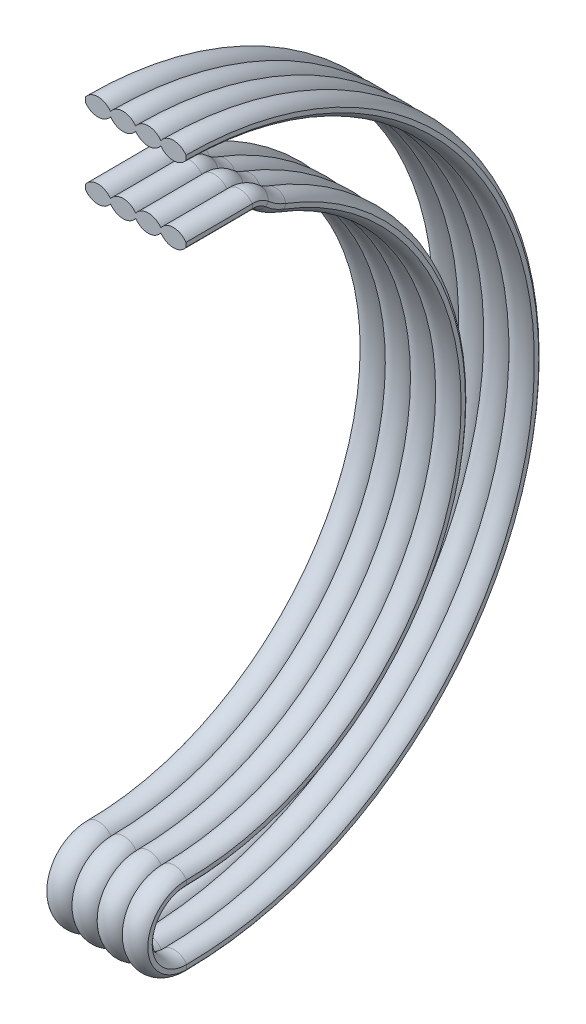
from build123d import *


with BuildPart() as part:
    # Sweep2: sweep along a path in Sketch2
    with BuildLine(Plane(origin=(0, 0, 0), x_dir=(0, 0, -1), z_dir=(1, 0, 0))) as sweep2_path:
        ThreePointArc((0, 3.81115331), (17.699989767, -13.869813883), (0.038065594, -31.588805759))
        ThreePointArc((0.038065594, -31.588805759), (-1.815908735, -29.742788644), (0.030108379, -27.888814315))
        ThreePointArc((0.030108379, -27.888814315), (13.769965036, -16.416308445), (5, -0.81214986))
        ThreePointArc((5, -0.81214986), (4.519062769, -0.576875394), (4.08786636, -0.259504395))
        ThreePointArc((4.08786636, -0.259504395), (3.742915742, -0.052424196), (3.346617497, 0.017008065))
        ThreePointArc((3.346617497, 0.017008065), (1.673330358, 0.004252044), (0, 0))
    # Sketch1 → Sweep2 (sweep)
    with BuildSketch(Plane.XY):
        with BuildLine():
            Line((-2.54, 0.111125), (-2.54, -0.111125))
            ThreePointArc((-2.54, -0.111125), (-1.905, -0.4445), (-1.27, -0.111125))
            ThreePointArc((-1.27, -0.111125), (-0.635, -0.4445), (0, -0.111125))
            ThreePointArc((0, -0.111125), (0.635, -0.4445), (1.27, -0.111125))
            ThreePointArc((1.27, -0.111125), (1.905, -0.4445), (2.54, -0.111125))
            Line((2.54, -0.111125), (2.54, 0.111125))
            ThreePointArc((2.54, 0.111125), (1.905, 0.4445), (1.27, 0.111125))
            ThreePointArc((1.27, 0.111125), (0.635, 0.4445), (0, 0.111125))
            ThreePointArc((0, 0.111125), (-0.635, 0.4445), (-1.27, 0.111125))
            ThreePointArc((-1.27, 0.111125), (-1.905, 0.4445), (-2.54, 0.111125))
        make_face()
    sweep(path=sweep2_path.line)


solid = part.part
